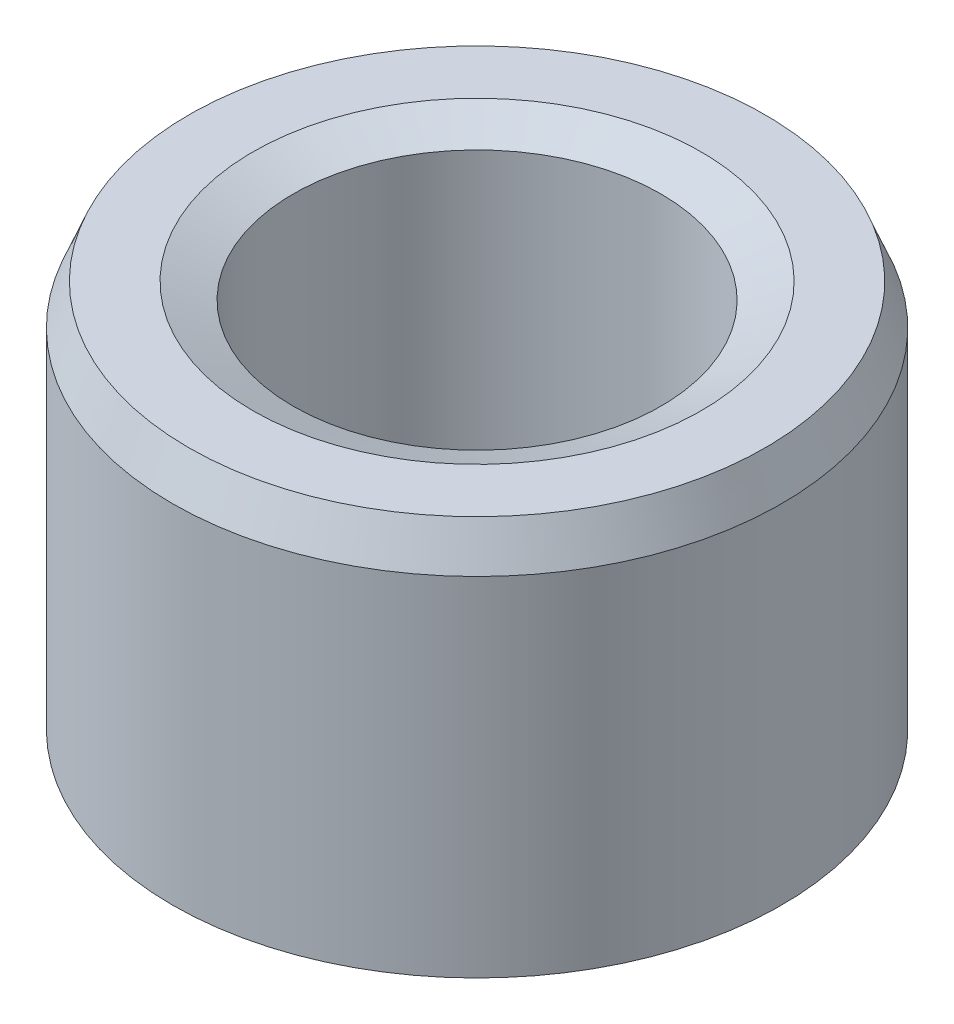
from build123d import *
from OCP.BRepFilletAPI import BRepFilletAPI_MakeChamfer

# Parameters (mm, degrees)
SKETCH1_R           = 20
BOSS_EXTRUDE1_DEPTH = 26.548351912
SKETCH2_R           = 12.076552456
CUT_EXTRUDE1_DEPTH  = 39.791944901
CHAMFER1_SIZE       = 2.647307289
CHAMFER1_SIZE2      = 1.067462255


with BuildPart() as part:
    # Sketch1 → Boss-Extrude1 (new body)
    with BuildSketch(Plane(origin=(0, 0, 0), x_dir=(1, 0, 0), z_dir=(0, 1, 0))):
        Circle(SKETCH1_R)
    extrude(amount=BOSS_EXTRUDE1_DEPTH)

    # Sketch2 → Cut-Extrude1 (cut, through all)
    with BuildSketch(Plane(origin=(0, 0, 0), x_dir=(1, 0, 0), z_dir=(0, 1, 0))):
        Circle(SKETCH2_R)
    extrude(amount=CUT_EXTRUDE1_DEPTH, mode=Mode.SUBTRACT)

    # Chamfer1: one chamfer whose edges measure the first distance from different faces: ONE call of the kernel's chamfer builder (chamfer() names one face for all edges)
    chamfer1_edges_1 = [part.edges().sort_by_distance(p)[0] for p in [
        (-12.076552456, 26.548351912, 0),
    ]]
    chamfer1_side_1 = [part.faces().sort_by_distance(p)[0] for p in [
        (-19.434314575, 26.548351912, 0),
    ]]
    chamfer1_edges_2 = [part.edges().sort_by_distance(p)[0] for p in [
        (-12.076552456, 0, 0),
    ]]
    chamfer1_side_2 = [part.faces().sort_by_distance(p)[0] for p in [
        (-12.076552456, 13.274175956, 0),
    ]]
    chamfer1_edges_3 = [part.edges().sort_by_distance(p)[0] for p in [
        (-20, 0, 0),
    ]]
    chamfer1_side_3 = [part.faces().sort_by_distance(p)[0] for p in [
        (-19.434314575, 0, 0),
    ]]
    chamfer1_edges_4 = [part.edges().sort_by_distance(p)[0] for p in [
        (-20, 26.548351912, 0),
    ]]
    chamfer1_side_4 = [part.faces().sort_by_distance(p)[0] for p in [
        (-20, 13.274175956, 0),
    ]]
    chamfer1 = BRepFilletAPI_MakeChamfer(part.part.solid().wrapped)
    for e in chamfer1_edges_1:
        chamfer1.Add(CHAMFER1_SIZE, CHAMFER1_SIZE2, e.wrapped, chamfer1_side_1[0].wrapped)  # the first distance lies on this face
    for e in chamfer1_edges_2:
        chamfer1.Add(CHAMFER1_SIZE, CHAMFER1_SIZE2, e.wrapped, chamfer1_side_2[0].wrapped)  # the first distance lies on this face
    for e in chamfer1_edges_3:
        chamfer1.Add(CHAMFER1_SIZE, CHAMFER1_SIZE2, e.wrapped, chamfer1_side_3[0].wrapped)  # the first distance lies on this face
    for e in chamfer1_edges_4:
        chamfer1.Add(CHAMFER1_SIZE, CHAMFER1_SIZE2, e.wrapped, chamfer1_side_4[0].wrapped)  # the first distance lies on this face
    add(Compound.cast(chamfer1.Shape()), mode=Mode.REPLACE)


solid = part.part
